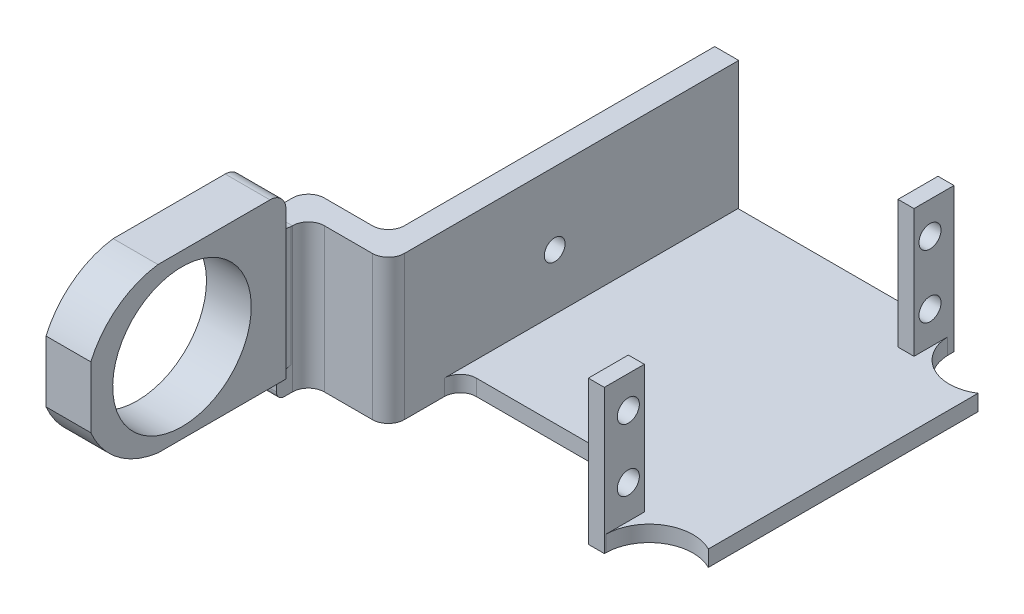
from build123d import *

# Parameters (mm, degrees)
SKETCH1_W            = 31.75
SKETCH1_H            = 55.515999966
BOSS_EXTRUDE1_DEPTH  = 2.54
SKETCH10_W           = 8.89
SKETCH10_H           = 3.81
BOSS_EXTRUDE6_DEPTH  = 22.86
SKETCH12_W           = 7.112
SKETCH12_H           = 25.908
BOSS_EXTRUDE7_DEPTH  = 31.75
SKETCH13_R           = 11
SKETCH13_R_2         = 1.65
CUT_EXTRUDE5_DEPTH   = 21.59
SKETCH14_W           = 0.762
SKETCH14_H           = 14.055075912
CUT_EXTRUDE6_DEPTH   = 12.7
SKETCH15_W           = 2.54
SKETCH15_H           = 6.35
BOSS_EXTRUDE8_DEPTH  = 22.86
SKETCH16_R           = 1.750000056
CUT_EXTRUDE7_DEPTH   = 7.62
SKETCH17_W           = 42.815999966
SKETCH17_H           = 2.54
BOSS_EXTRUDE9_DEPTH  = 12.7
SKETCH18_W           = 5.08
SKETCH18_H           = 6.35
BOSS_EXTRUDE10_DEPTH = 2.54
CUT_EXTRUDE9_DEPTH   = 2.54
FILLET1_R            = 1.27
FILLET2_R            = 2.54
FILLET3_START        = 3.81
FILLET3_DEPTH        = 19.0499999
FILLET3_START_2      = 22.8599999
FILLET3_2_DEPTH      = 2.5400001
FILLET3_START_3      = -33
FILLET3_3_DEPTH      = 8.205718734


with BuildPart() as part:
    # Sketch1 → Boss-Extrude1 (new body)
    with BuildSketch(Plane(origin=(0, 0, 0), x_dir=(1, 0, 0), z_dir=(0, 1, 0))):
        with Locations((2.256707018, -2.686772311)):
            Rectangle(SKETCH1_W, SKETCH1_H)
    extrude(amount=BOSS_EXTRUDE1_DEPTH)

    # Sketch10 → Boss-Extrude6 (add)
    with BuildSketch(Plane(origin=(0, 0, 0), x_dir=(-1, 0, 0), z_dir=(0, -1, 0))):
        Polygon((13.618292982, 25.071227672), (13.618292982, -30.444772294), (17.428292982, -30.444772294), (17.428292982, -26.634772294), (17.428292982, 25.177062632), (13.618292982, 25.177062632), align=None)
        with Locations((21.873292982, -28.539772294)):
            Rectangle(SKETCH10_W, SKETCH10_H)
        Polygon((26.318292982, -26.634772294), (26.318292982, -30.444772294), (26.318292982, -35.526292066), (30.128292982, -35.526292066), (30.128292982, -26.634772294), align=None)
    extrude(amount=-BOSS_EXTRUDE6_DEPTH)

    # Sketch12 → Boss-Extrude7 (add)
    with BuildSketch(Plane.XY.offset(35.526292066)):
        with Locations((-28.350292982, 16.764)):
            Rectangle(SKETCH12_W, SKETCH12_H)
    extrude(amount=BOSS_EXTRUDE7_DEPTH)

    # Sketch13 → Cut-Extrude5 (cut)
    with BuildSketch(Plane.ZY.offset(31.906292982)):
        with BuildLine():
            Line((67.276292066, 3.81), (67.276292066, 14.316171348))
            ThreePointArc((67.276292066, 14.316171348), (63.220762226, 7.257694985), (55.846292066, 3.81))
            Line((55.846292066, 3.81), (67.276292066, 3.81))
        make_face()
        with BuildLine():
            ThreePointArc((55.846292066, 29.718), (63.159812447, 26.327226274), (67.276292066, 19.396171348))
            Line((67.276292066, 19.396171348), (67.276292066, 29.718))
            Line((67.276292066, 29.718), (55.846292066, 29.718))
        make_face()
        with Locations(Location((52.036292066, 16.51, 0), (0, 0, 270))):
            Circle(SKETCH13_R)
        with Locations((4.032937368, 11.43)):
            Circle(SKETCH13_R_2)
    extrude(amount=-CUT_EXTRUDE5_DEPTH, mode=Mode.SUBTRACT)

    # Sketch14 → Cut-Extrude6 (cut)
    with BuildSketch(Plane.ZY.offset(31.906292982)):
        with Locations((66.895292066, 16.391473574)):
            Rectangle(SKETCH14_W, SKETCH14_H)
    extrude(amount=-CUT_EXTRUDE6_DEPTH, mode=Mode.SUBTRACT)

    # Sketch15 → Boss-Extrude8 (add)
    with BuildSketch(Plane.XZ):
        with Locations((19.401707018, -21.896227672)):
            Rectangle(SKETCH15_W, SKETCH15_H)
        with Locations((19.401707018, 27.269772294)):
            Rectangle(SKETCH15_W, SKETCH15_H)
    extrude(amount=-BOSS_EXTRUDE8_DEPTH)

    # Sketch16 → Cut-Extrude7 (cut)
    with BuildSketch(Plane(origin=(20.671707018, 0, 0), x_dir=(0, 0, -1), z_dir=(1, 0, 0))):
        with Locations((-26.634772294, 7.874)):
            Circle(SKETCH16_R)
        with Locations((-26.634772294, 17.78)):
            Circle(SKETCH16_R)
        with Locations((21.261227672, 7.78)):
            Circle(SKETCH16_R)
        with Locations((21.261227672, 17.78)):
            Circle(SKETCH16_R)
    extrude(amount=-CUT_EXTRUDE7_DEPTH, mode=Mode.SUBTRACT)

    # Sketch17 → Boss-Extrude9 (add)
    with BuildSketch(Plane(origin=(18.131707018, 0, 0), x_dir=(0, 0, -1), z_dir=(1, 0, 0))):
        with Locations((-2.686772311, 1.27)):
            Rectangle(SKETCH17_W, SKETCH17_H)
    extrude(amount=BOSS_EXTRUDE9_DEPTH)

    # Sketch18 → Boss-Extrude10 (add)
    with BuildSketch(Plane(origin=(0, 2.54, 0), x_dir=(1, 0, 0), z_dir=(0, 1, 0))):
        with Locations((23.211707018, 21.896227672)):
            Rectangle(SKETCH18_W, SKETCH18_H)
        with Locations((23.211707018, -27.269772294)):
            Rectangle(SKETCH18_W, SKETCH18_H)
    extrude(amount=-BOSS_EXTRUDE10_DEPTH)

    # Sketch19 → Cut-Extrude9 (cut)
    with BuildSketch(Plane(origin=(0, 2.54, 0), x_dir=(1, 0, 0), z_dir=(0, 1, 0))):
        with BuildLine():
            Line((25.751707018, 25.071227672), (20.671707018, 25.071227672))
            Line((20.671707018, 25.071227672), (20.671707018, 24.618530893))
            Line((20.671707018, 24.618530893), (20.671707018, 24.032468758))
            ThreePointArc((20.671707018, 24.032468758), (21.560891333, 20.998252578), (23.754580952, 18.721227672))
            Line((23.754580952, 18.721227672), (25.751707018, 18.721227672))
            Line((25.751707018, 18.721227672), (25.751707018, 25.071227672))
        make_face()
        with BuildLine():
            Line((30.831707018, 18.721227672), (25.751707018, 18.721227672))
            Line((25.751707018, 18.721227672), (23.754580952, 18.721227672))
            ThreePointArc((23.754580952, 18.721227672), (27.293143985, 17.697581999), (30.831707018, 18.721227672))
        make_face()
        with BuildLine():
            ThreePointArc((18.131707018, -29.988694367), (15.379086377, -22.799421621), (8.675431219, -19.014772294))
            Line((8.675431219, -19.014772294), (-13.618292982, -19.014772294))
            Line((-13.618292982, -19.014772294), (-13.618292982, -30.444772294))
            Line((-13.618292982, -30.444772294), (18.131707018, -30.444772294))
            Line((18.131707018, -30.444772294), (18.131707018, -29.988694367))
        make_face()
        with BuildLine():
            Line((25.751707018, -24.094772294), (30.831707018, -24.094772294))
            ThreePointArc((30.831707018, -24.094772294), (24.069006733, -24.315202296), (20.671707018, -30.166788334))
            Line((20.671707018, -30.166788334), (20.671707018, -30.444772294))
            Line((20.671707018, -30.444772294), (25.751707018, -30.444772294))
            Line((25.751707018, -30.444772294), (25.751707018, -24.094772294))
        make_face()
    extrude(amount=-CUT_EXTRUDE9_DEPTH, mode=Mode.SUBTRACT)

    # Fillet1
    fillet1_edges = [part.edges().sort_by_distance(p)[0] for p in [
        (-28.223292982, 0, 35.526292066),
        (-28.223292982, 3.81, 35.526292066),
    ]]
    fillet(fillet1_edges, radius=FILLET1_R)

    # Fillet2
    fillet2_edges = [part.edges().sort_by_distance(p)[0] for p in [
        (-26.318292982, 11.43, 30.444772294),
        (-13.618292982, 11.43, 30.444772294),
        (-17.428292982, 11.43, 26.634772294),
        (-30.128292982, 11.43, 26.634772294),
        (-28.223292982, 22.86, 35.526292066),
        (-13.618292982, 1.27, 19.014772294),
        (-28.350292982, 29.718, 35.526292066),
    ]]
    fillet(fillet2_edges, radius=FILLET2_R)

    # Fillet3: read off the stored shape, not the designer's step
    # Fillet3 outline → Fillet3 (add)
    with BuildSketch(Plane(origin=(0, 0, 0), x_dir=(1, 0, 0), z_dir=(0, 1, 0)).offset(FILLET3_START)):
        with BuildLine():
            Line((-26.318292982, -35.526292066), (-24.794272712, -35.526300912))
            ThreePointArc((-24.794272712, -35.526300912), (-25.903403393, -34.589568161), (-26.318292982, -33.198343613))
            Line((-26.318292982, -33.198343613), (-26.318292982, -35.526292066))
        make_face()
        with BuildLine():
            Line((-31.906292982, -35.526292066), (-30.128292982, -35.526292066))
            Line((-30.128292982, -35.526292066), (-30.128292982, -33.103286494))
            ThreePointArc((-30.128292982, -33.103286494), (-30.620479514, -34.605970759), (-31.906292982, -35.526292066))
        make_face()
    extrude(amount=FILLET3_DEPTH)

    # Fillet3 2 outline → Fillet3 2 (add)
    with BuildSketch(Plane(origin=(0, 0, 0), x_dir=(1, 0, 0), z_dir=(0, 1, 0)).offset(FILLET3_START_2)):
        with BuildLine():
            Line((-26.318292982, -35.526292066), (-24.794272712, -35.526300912))
            ThreePointArc((-24.794272712, -35.526300912), (-25.903403393, -34.589568161), (-26.318292982, -33.198343613))
            Line((-26.318292982, -33.198343613), (-26.318292982, -35.526292066))
        make_face()
        with BuildLine():
            Line((-31.906292982, -35.526292066), (-30.128292982, -35.526292066))
            Line((-30.128292982, -35.526292066), (-30.128292982, -33.103286494))
            ThreePointArc((-30.128292982, -33.103286494), (-30.620479514, -34.605970759), (-31.906292982, -35.526292066))
        make_face()
    extrude(amount=FILLET3_2_DEPTH)

    # Fillet3 3 outline → Fillet3 3 (cut)
    with BuildSketch(Plane.YZ.offset(FILLET3_START_3)):
        with BuildLine():
            Line((25.4, 32), (25.4, 35.526292066))
            ThreePointArc((25.4, 35.526292066), (23.603948776, 34.78234329), (22.86, 32.986292066))
            Line((22.86, 32.986292066), (22.86, 32))
            Line((22.86, 32), (25.4, 32))
        make_face()
    extrude(amount=FILLET3_3_DEPTH, mode=Mode.SUBTRACT)


solid = part.part
